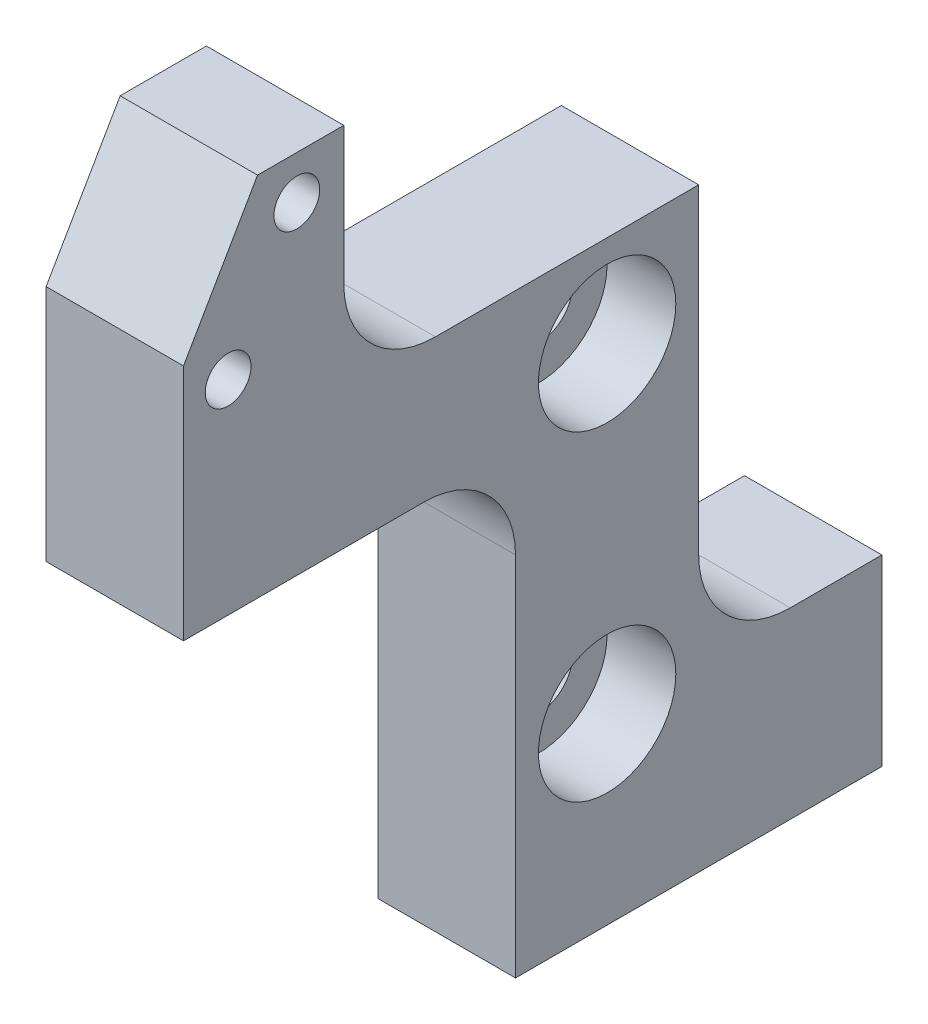
from build123d import *

# Parameters (mm, degrees)
SKETCH1_R                       = 1.5
SKETCH1_R_2                     = 1
BOSS_EXTRUDE1_DEPTH             = 6
FILLET1_R                       = 4
TAP_DRILL_FOR_M3X0_5_TAP1_D     = 2.5
TAP_DRILL_FOR_M3X0_5_TAP1_DEPTH = 4
SKETCH4_R                       = 1
CUT_EXTRUDE1_DEPTH              = 3
SKETCH5_R                       = 3
CUT_EXTRUDE2_DEPTH              = 3


with BuildPart() as part:
    # Sketch1 → Boss-Extrude1 (new body)
    with BuildSketch(Plane(origin=(0, 0, 0), x_dir=(0, 0, -1), z_dir=(1, 0, 0))):
        Polygon((30.5, 0), (14.5, 0), (14.5, 20), (0, 20), (0, 30.4), (3.233161507, 36), (7, 36), (7, 26), (22.5, 26), (22.5, 8), (30.5, 8), align=None)
        with Locations((18.5, 8)):
            Circle(SKETCH1_R, mode=Mode.SUBTRACT)
        with Locations((18.5, 22)):
            Circle(SKETCH1_R, mode=Mode.SUBTRACT)
        with Locations((1.95, 28.91)):
            Circle(SKETCH1_R_2, mode=Mode.SUBTRACT)
        with Locations((4.95, 34.106152423)):
            Circle(SKETCH1_R_2, mode=Mode.SUBTRACT)
    extrude(amount=BOSS_EXTRUDE1_DEPTH)

    # Fillet1
    fillet1_edges = [part.edges().sort_by_distance(p)[0] for p in [
        (3, 8, -22.5),
        (3, 20, -14.5),
        (3, 26, -7),
    ]]
    fillet(fillet1_edges, radius=FILLET1_R)

    # Tap Drill for M3x0.5 Tap1
    with Locations(Plane(origin=(0, 0, 0), x_dir=(-1, 0, 0), z_dir=(0, -1, 0))):
        with Locations((-3, 17.5), (-3, 27.5)):
            Hole(TAP_DRILL_FOR_M3X0_5_TAP1_D / 2, depth=TAP_DRILL_FOR_M3X0_5_TAP1_DEPTH)

    # Sketch4 → Cut-Extrude1 (cut)
    with BuildSketch(Plane.XZ):
        with Locations((3, -22.5)):
            Circle(SKETCH4_R)
    extrude(amount=-CUT_EXTRUDE1_DEPTH, mode=Mode.SUBTRACT)

    # Sketch5 → Cut-Extrude2 (cut)
    with BuildSketch(Plane(origin=(6, 0, 0), x_dir=(0, 0, -1), z_dir=(1, 0, 0))):
        with Locations((18.5, 22)):
            Circle(SKETCH5_R)
        with Locations((18.5, 8)):
            Circle(SKETCH5_R)
    extrude(amount=-CUT_EXTRUDE2_DEPTH, mode=Mode.SUBTRACT)


solid = part.part
